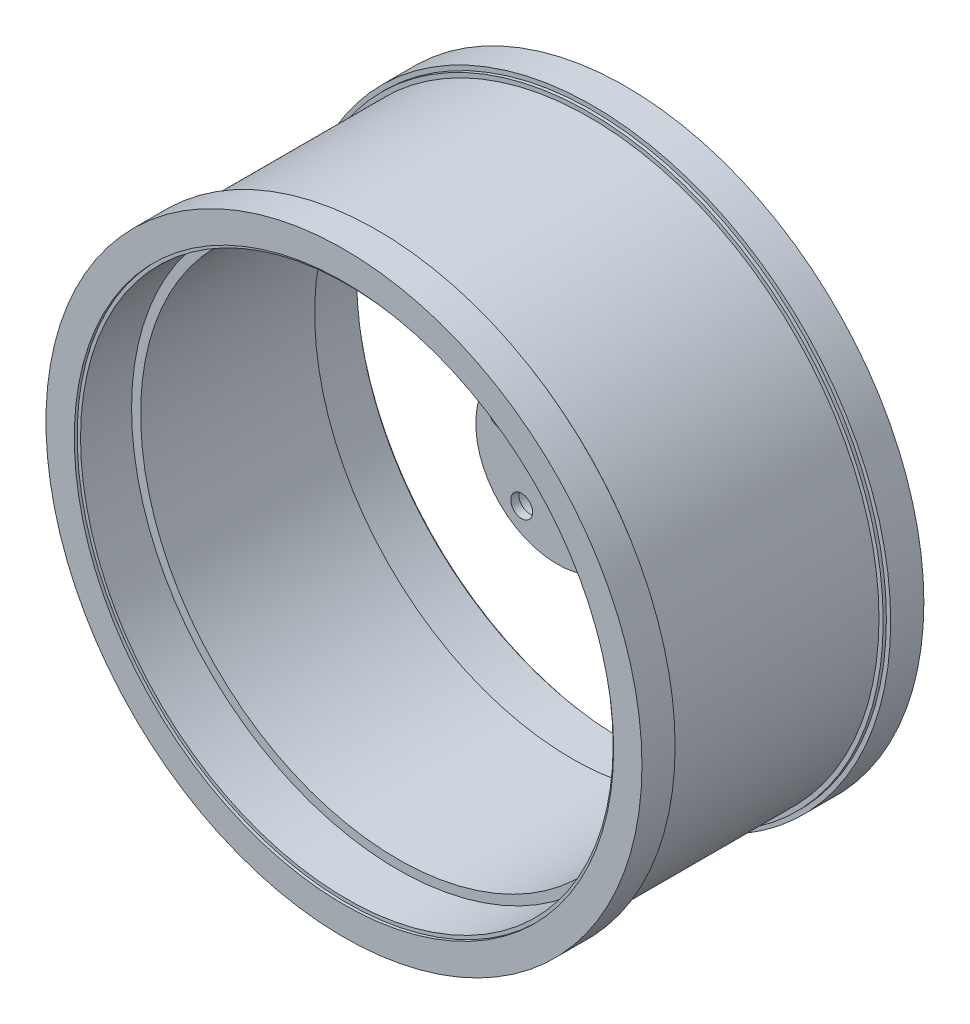
from build123d import *

# Parameters (mm, degrees)
SKETCH1_R               = 25.4
BOSS_EXTRUDE1_DEPTH     = 12.7
SKETCH2_R               = 22.86
CUT_EXTRUDE1_DEPTH      = 7.62
SKETCH3_R               = 12.7
BOSS_EXTRUDE2_DEPTH     = 5.08
SKETCH4_R               = 11.43
CUT_EXTRUDE2_DEPTH      = 2.54
FILLET1_R               = 0.254
BOSS_EXTRUDE4_START     = 2.54
SKETCH5_R               = 11.43
BOSS_EXTRUDE4_DEPTH     = 2.54
FILLET2_R               = 0.254
CUT_EXTRUDE3_DEPTH      = 12.7
CUT_EXTRUDE3_DEPTH_BACK = 2.54
SKETCH6_R               = 5.08
SKETCH7_R               = 3.413587484
CUT_EXTRUDE4_DEPTH      = 20.32


with BuildPart() as part:
    # Sketch1 → Boss-Extrude1 (new body)
    with BuildSketch(Plane.XY):
        Circle(SKETCH1_R)
    extrude(amount=BOSS_EXTRUDE1_DEPTH)

    # Sketch2 → Cut-Extrude1 (cut)
    with BuildSketch(Plane.XY):
        Circle(SKETCH2_R)
    extrude(amount=CUT_EXTRUDE1_DEPTH, mode=Mode.SUBTRACT)

    # Sketch3 → Boss-Extrude2 (add)
    with BuildSketch(Plane(origin=(0, 0, 7.62), x_dir=(-1, 0, 0), z_dir=(0, 0, -1))):
        with Locations(Location((0, 0, 0), (0, 0, 180))):
            Circle(SKETCH3_R)
    extrude(amount=BOSS_EXTRUDE2_DEPTH)

    # Sketch4 → Cut-Extrude2 (cut)
    with BuildSketch(Plane(origin=(0, 0, 2.54), x_dir=(-1, 0, 0), z_dir=(0, 0, -1))):
        Circle(SKETCH4_R)
    extrude(amount=-CUT_EXTRUDE2_DEPTH, mode=Mode.SUBTRACT)

    # Fillet1
    fillet1_edges = [part.edges().sort_by_distance(p)[0] for p in [
        (-12.7, 0, 2.54),
        (11.43, 0, 2.54),
        (-12.7, 0, 7.62),
    ]]
    fillet(fillet1_edges, radius=FILLET1_R)

    # Sketch5 → Boss-Extrude4 (add)
    with BuildSketch(Plane(origin=(0, 0, 5.08), x_dir=(-1, 0, 0), z_dir=(0, 0, -1)).offset(BOSS_EXTRUDE4_START)):
        with Locations(Location((0, 0, 0), (0, 0, 180))):
            Circle(SKETCH5_R)
    extrude(amount=-BOSS_EXTRUDE4_DEPTH)

    # Fillet2
    fillet2_edges = [part.edges().sort_by_distance(p)[0] for p in [
        (-11.43, 0, 2.54),
    ]]
    fillet(fillet2_edges, radius=FILLET2_R - 0.0001)  # a hair under: the kernel refuses the full size

    # Sketch6 → Cut-Extrude3 (cut, two sides: drawn at the far end of the back side and taken through both)
    with BuildSketch(Plane(origin=(0, 0, 7.62), x_dir=(-1, 0, 0), z_dir=(0, 0, -1)).offset(-CUT_EXTRUDE3_DEPTH_BACK)):
        with Locations(Location((0, 18.803618602, 0), (0, 0, 131.448803195))):
            Circle(SKETCH6_R)
        with Locations(Location((17.883304001, 5.810637704, 0), (0, 0, 59.448803195))):
            Circle(SKETCH6_R)
        with Locations(Location((11.052489704, -15.212447005, 0), (0, 0, 264.551196805))):
            Circle(SKETCH6_R)
        with Locations(Location((-11.052489704, -15.212447005, 0), (0, 0, 192.551196805))):
            Circle(SKETCH6_R)
        with Locations(Location((-17.883304001, 5.810637704, 0), (0, 0, 203.448803195))):
            Circle(SKETCH6_R)
    extrude(amount=CUT_EXTRUDE3_DEPTH + CUT_EXTRUDE3_DEPTH_BACK, mode=Mode.SUBTRACT)

    # Sketch7 → Cut-Extrude4 (cut)
    with BuildSketch(Plane(origin=(0, 0, 7.62), x_dir=(-1, 0, 0), z_dir=(0, 0, -1))):
        with Locations((0, 18.803618602)):
            Circle(SKETCH7_R)
        with Locations((17.883304001, 5.810637704)):
            Circle(SKETCH7_R)
        with Locations((11.052489704, -15.212447005)):
            Circle(SKETCH7_R)
        with Locations((-11.052489704, -15.212447005)):
            Circle(SKETCH7_R)
        with Locations((-17.883304001, 5.810637704)):
            Circle(SKETCH7_R)
    extrude(amount=-CUT_EXTRUDE4_DEPTH, mode=Mode.SUBTRACT)


with BuildPart() as body_2:
    # Sketch19 → Revolve-Thin1 (revolve)
    with BuildSketch(Plane(origin=(0, 0, 0), x_dir=(0, 0, -1), z_dir=(1, 0, 0)), mode=Mode.PRIVATE) as revolve_thin1_sk:
        Polygon((-68.951560873, 93.179231942), (-79.322712681, 93.179231942), (-79.322712681, 84.32215678), (-78.422107256, 84.32215678), (-78.422107256, 83.271450451), (-62.463601708, 83.271450451), (-62.463601708, 80.444085829), (-8.034640185, 80.444085829), (-8.034640185, 83.271450451), (7.923865363, 83.271450451), (7.923865363, 84.32215678), (8.824470788, 84.32215678), (8.824470788, 93.179231942), (-1.54668102, 93.179231942), (-1.54668102, 91.828323804), (-2.54, 91.828323804), (-2.54, 90.511552188), (-67.958241893, 90.511552188), (-67.958241893, 91.828323804), (-68.951560873, 91.828323804), align=None)
        Polygon((-71.491560873, 90.639231942), (-76.782712681, 90.639231942), (-76.782712681, 86.86215678), (-75.882107256, 86.86215678), (-75.882107256, 85.811450451), (-59.923601708, 85.811450451), (-59.923601708, 82.984085829), (-10.574640185, 82.984085829), (-10.574640185, 85.811450451), (5.383865363, 85.811450451), (5.383865363, 86.86215678), (6.284470788, 86.86215678), (6.284470788, 90.639231942), (0.99331898, 90.639231942), (0.99331898, 89.288323804), (0, 89.288323804), (0, 87.971552188), (-70.498241893, 87.971552188), (-70.498241893, 89.288323804), (-71.491560873, 89.288323804), align=None, mode=Mode.SUBTRACT)
    revolve(revolve_thin1_sk.sketch.rotate(Axis((0, 0, 179.387196219), (0, 0, -1)), 90), axis=Axis((0, 0, 179.387196219), (0, 0, -1)))


solid = Compound([part.part, body_2.part])
